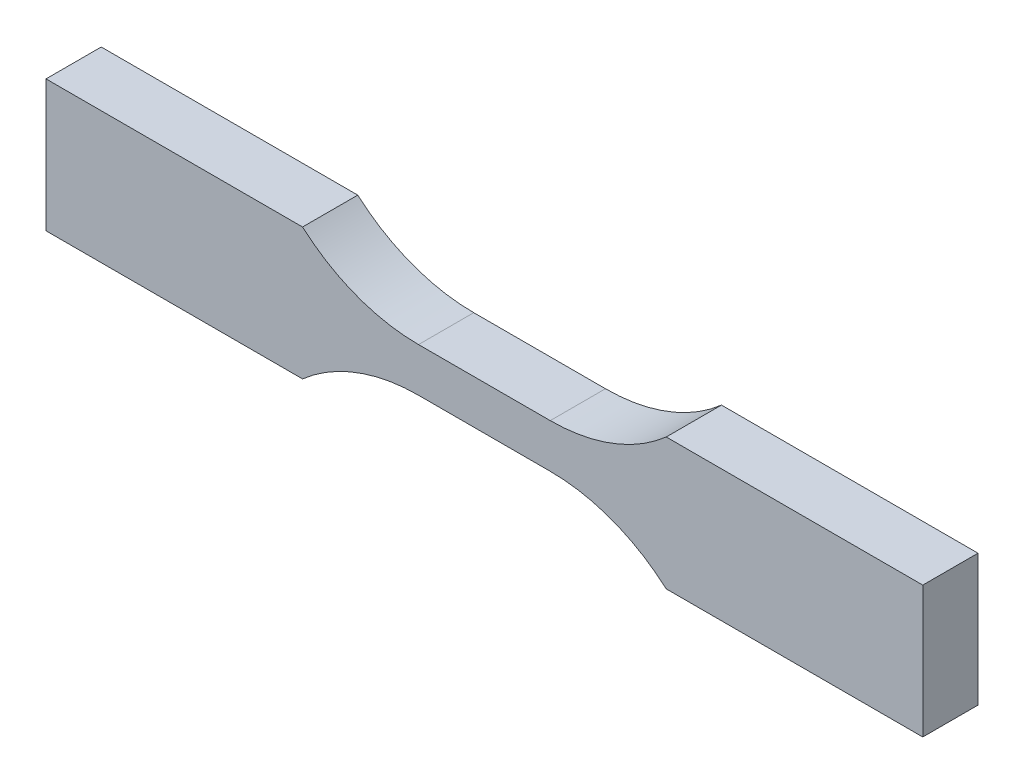
from build123d import *

# Parameters (mm, degrees)
BOSS_EXTRUDE1_DEPTH = 2
FILLET1_R           = 12.7
FILLET2_R           = 12.7


with BuildPart() as part:
    # Sketch1 → Boss-Extrude1 (new, symmetric)
    with BuildSketch(Plane.XY):
        Polygon((0, 0), (0, 9.53), (18.58, 9.53), (18.58, 6.355), (44.92, 6.355), (44.92, 9.53), (63.5, 9.53), (63.5, 0), (44.92, 0), (44.92, 3.175), (18.58, 3.175), (18.58, 0), align=None)
    extrude(amount=BOSS_EXTRUDE1_DEPTH, both=True)

    # Fillet1
    # the kernel refuses this fillet: 12.7 mm, written as the material it adds along each edge
    with BuildSketch(Plane(origin=(44.92, 3.175, 2), x_dir=(-1, 0, 0), z_dir=(0, 0, -1))) as fillet1_piece_1:
        with BuildLine():
            CenterArc((8.400260413, -12.7), FILLET1_R, 90, 41.409622109)
            Line((0, -3.175), (-0.168005208, -2.9845))
            ThreePointArc((-0.168005208, -2.9845), (-0.254, -1.5875), (-0.254, 0))
            Line((-0.254, 0), (0, 0.254))
            Line((0, 0.254), (8.400260413, 0.254))
            Line((8.400260413, 0.254), (8.400260413, 0))
        make_face()
    extrude(amount=4)
    with BuildSketch(Plane(origin=(18.58, 3.175, -2), x_dir=(0, -1, 0), z_dir=(0, 0, 1))) as fillet1_piece_2:
        with BuildLine():
            CenterArc((12.7, 8.400260413), FILLET1_R, 180, 41.409622109)
            Line((0, 8.400260413), (-0.254, 8.400260413))
            Line((-0.254, 8.400260413), (-0.254, 0))
            Line((-0.254, 0), (0, -0.254))
            ThreePointArc((0, -0.254), (1.5875, -0.254), (2.9845, -0.168005208))
            Line((2.9845, -0.168005208), (3.175, 0))
        make_face()
    extrude(amount=4)

    # Fillet2
    # the kernel refuses this fillet: 12.7 mm, written as the material it adds along each edge
    with BuildSketch(Plane(origin=(44.92, 6.355, 2), x_dir=(-1, 0, 0), z_dir=(0, 0, -1))) as fillet2_piece_1:
        with BuildLine():
            CenterArc((8.400260413, 12.7), FILLET2_R, 228.590377891, 41.409622109)
            Line((0, 3.175), (-0.168005208, 2.9845))
            ThreePointArc((-0.168005208, 2.9845), (-0.254, 1.5875), (-0.254, 0))
            Line((-0.254, 0), (0, -0.254))
            Line((0, -0.254), (8.400260413, -0.254))
            Line((8.400260413, -0.254), (8.400260413, 0))
        make_face()
    extrude(amount=4)
    with BuildSketch(Plane(origin=(18.58, 6.355, 2), x_dir=(0, 1, 0), z_dir=(0, 0, -1))) as fillet2_piece_2:
        with BuildLine():
            CenterArc((12.7, 8.400260413), FILLET2_R, 180, 41.409622109)
            Line((0, 8.400260413), (-0.254, 8.400260413))
            Line((-0.254, 8.400260413), (-0.254, 0))
            Line((-0.254, 0), (0, -0.254))
            ThreePointArc((0, -0.254), (1.5875, -0.254), (2.9845, -0.168005208))
            Line((2.9845, -0.168005208), (3.175, 0))
        make_face()
    extrude(amount=4)


solid = part.part
